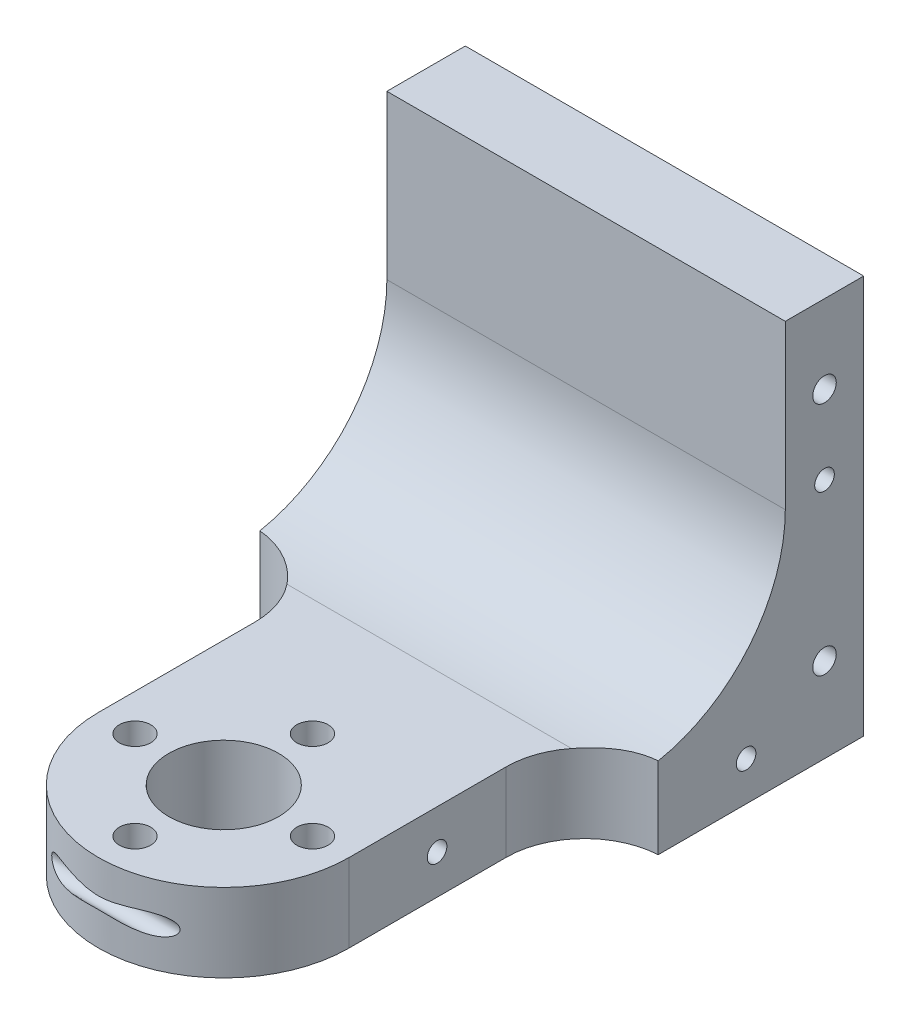
from build123d import *

# Parameters (mm, degrees)
SKETCH1_W           = 50.8
SKETCH1_H           = 66.2
SKETCH1_R           = 2
SKETCH1_R_2         = 7
BOSS_EXTRUDE1_DEPTH = 10
SKETCH2_W           = 50.8
SKETCH2_H           = 50.8
BOSS_EXTRUDE2_DEPTH = 10
FILLET2_R           = 20
SKETCH3_R           = 1.25
CUT_EXTRUDE1_DEPTH  = 105.726882891
SKETCH4_R           = 1.25
SKETCH4_R_2         = 1.5
CUT_EXTRUDE2_DEPTH  = 105.726882939
CUT_EXTRUDE3_DEPTH  = 105.726882939
FILLET3_DEPTH       = 10.364318194
FILLET3_START       = -1
FILLET3_2_DEPTH     = 53


with BuildPart() as part:
    # Sketch1 → Boss-Extrude1 (new body)
    with BuildSketch(Plane(origin=(0, 0, 0), x_dir=(1, 0, 0), z_dir=(0, 1, 0))):
        with Locations((25.4, 33.1)):
            Rectangle(SKETCH1_W, SKETCH1_H)
        with Locations(Location((14.086291501, 20, 0), (0, 0, 270))):
            Circle(SKETCH1_R, mode=Mode.SUBTRACT)
        with Locations(Location((25.4, 8.686291501, 0), (0, 0, 270))):
            Circle(SKETCH1_R, mode=Mode.SUBTRACT)
        with Locations(Location((36.713708499, 20, 0), (0, 0, 270))):
            Circle(SKETCH1_R, mode=Mode.SUBTRACT)
        with Locations(Location((25.4, 31.313708499, 0), (0, 0, 270))):
            Circle(SKETCH1_R, mode=Mode.SUBTRACT)
        with Locations(Location((25.4, 20, 0), (0, 0, 270))):
            Circle(SKETCH1_R_2, mode=Mode.SUBTRACT)
    extrude(amount=BOSS_EXTRUDE1_DEPTH)

    # Sketch2 → Boss-Extrude2 (add)
    with BuildSketch(Plane(origin=(0, 0, -66.2), x_dir=(-1, 0, 0), z_dir=(0, 0, -1))):
        with Locations((-25.4, 25.4)):
            Rectangle(SKETCH2_W, SKETCH2_H)
    extrude(amount=BOSS_EXTRUDE2_DEPTH)

    # Fillet2
    fillet2_edges = [part.edges().sort_by_distance(p)[0] for p in [
        (25.4, 10, -66.2),
    ]]
    fillet(fillet2_edges, radius=FILLET2_R)

    # Sketch3 → Cut-Extrude1 (cut, through all)
    with BuildSketch(Plane(origin=(50.8, 0, 0), x_dir=(0, 0, -1), z_dir=(1, 0, 0))):
        with Locations((61.2, 5)):
            Circle(SKETCH3_R)
        with Locations((31.2, 5)):
            Circle(SKETCH3_R)
        with Locations((5, 5)):
            Circle(SKETCH3_R)
    extrude(amount=-CUT_EXTRUDE1_DEPTH, mode=Mode.SUBTRACT)

    # Sketch4 → Cut-Extrude2 (cut, through all)
    with BuildSketch(Plane(origin=(50.8, 0, 0), x_dir=(0, 0, -1), z_dir=(1, 0, 0))):
        with Locations((71.2, -9.2)):
            Circle(SKETCH4_R)
        with Locations((71.2, 30.8)):
            Circle(SKETCH4_R)
        with Locations((71.2, 10.8)):
            Circle(SKETCH4_R_2)
        with Locations((71.2, 40.8)):
            Circle(SKETCH4_R_2)
    extrude(amount=-CUT_EXTRUDE2_DEPTH, mode=Mode.SUBTRACT)

    # Sketch5 → Cut-Extrude3 (cut, through all)
    with BuildSketch(Plane(origin=(0, 0, 0), x_dir=(-1, 0, 0), z_dir=(0, -1, 0))):
        with BuildLine():
            ThreePointArc((-25.4, 4), (-36.713708499, 8.686291501), (-41.4, 20))
            Line((-41.4, 20), (-41.4, 50))
            Line((-41.4, 50), (-50.8, 50))
            Line((-50.8, 50), (-50.8, 0))
            Line((-50.8, 0), (0, 0))
            Line((0, 0), (0, 50))
            Line((0, 50), (-9.4, 50))
            Line((-9.4, 50), (-9.4, 20))
            ThreePointArc((-9.4, 20), (-14.086291501, 8.686291501), (-25.4, 4))
        make_face()
    extrude(amount=-CUT_EXTRUDE3_DEPTH, mode=Mode.SUBTRACT)

    # Fillet3: read off the stored shape, not the designer's step
    # Fillet3 outline → Fillet3 (add)
    with BuildSketch(Plane(origin=(0, 0, 0), x_dir=(1, 0, 0), z_dir=(0, 1, 0))):
        with BuildLine():
            ThreePointArc((0, 50), (6.680109889, 46.87367083), (9.4, 40.018016229))
            Line((9.4, 40.018016229), (9.4, 50))
            Line((9.4, 50), (0, 50))
        make_face()
        with BuildLine():
            ThreePointArc((41.4, 40.018016229), (44.119890111, 46.87367083), (50.8, 50))
            Line((50.8, 50), (41.4, 50))
            Line((41.4, 50), (41.4, 40.018016229))
        make_face()
    extrude(amount=FILLET3_DEPTH)

    # Fillet3 2 outline → Fillet3 2 (cut)
    with BuildSketch(Plane.YZ.offset(FILLET3_START)):
        with BuildLine():
            ThreePointArc((10, -46.2), (10.091287885, -48.108712115), (10.364318194, -50))
            ThreePointArc((10.364318194, -50), (10.586120766, -51.006380458), (10.859467092, -52))
            Line((10.859467092, -52), (12, -52))
            Line((12, -52), (12, -39))
            Line((12, -39), (10, -39))
            Line((10, -39), (10, -46.2))
        make_face()
    extrude(amount=FILLET3_2_DEPTH, mode=Mode.SUBTRACT)


solid = part.part
